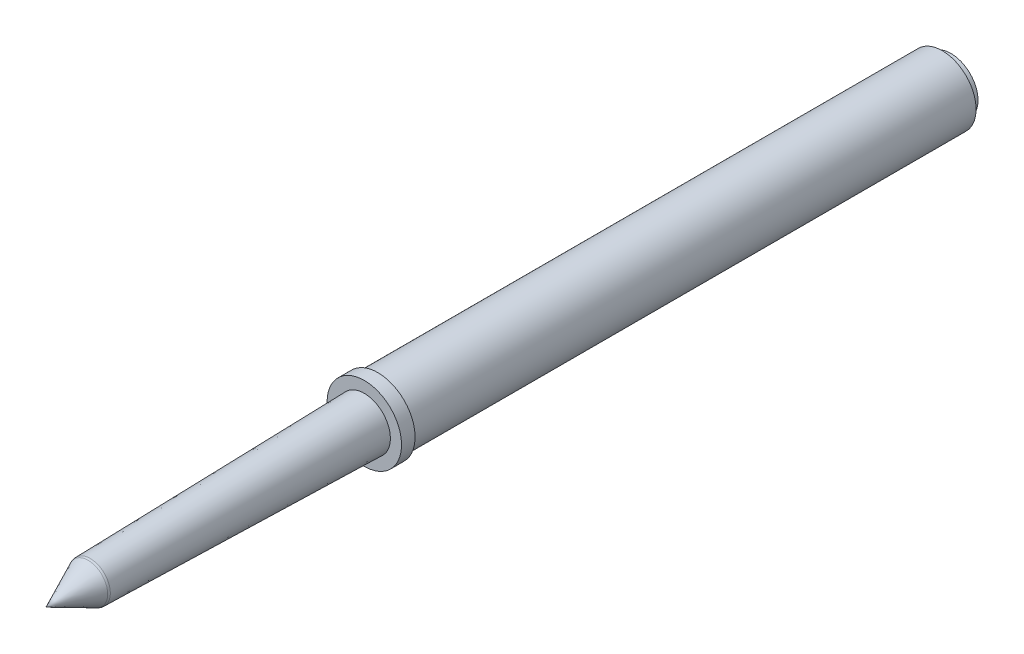
from build123d import *


with BuildPart() as part:
    # Sketch3 → Revolve2 (revolve)
    with BuildSketch(Plane(origin=(0, 0, 0), x_dir=(0, 0, -1), z_dir=(1, 0, 0))):
        with BuildLine():
            Line((-212.242071788, 0), (-203.086630038, 0))
            Line((-203.086630038, 0), (0, 0))
            Line((0, 0), (0, 6.35))
            Line((0, 6.35), (-2.045445357, 6.35))
            Line((-2.045445357, 6.35), (-2.045445357, 7.9375))
            Line((-2.045445357, 7.9375), (-134.411630038, 7.9375))
            Line((-134.411630038, 7.9375), (-134.411630038, 8.73125))
            Line((-134.411630038, 8.73125), (-137.586630038, 8.73125))
            Line((-137.586630038, 8.73125), (-137.586630038, 6.109884817))
            Line((-137.586630038, 6.109884817), (-201.844702811, 4.689142192))
            ThreePointArc((-201.844702811, 4.689142192), (-202.103101103, 4.656721397), (-202.349453582, 4.572274718))
            Line((-202.349453582, 4.572274718), (-212.242071788, 0))
        make_face()
    revolve(axis=Axis((0, 0, 0), (0, 0, 1)))


solid = part.part
